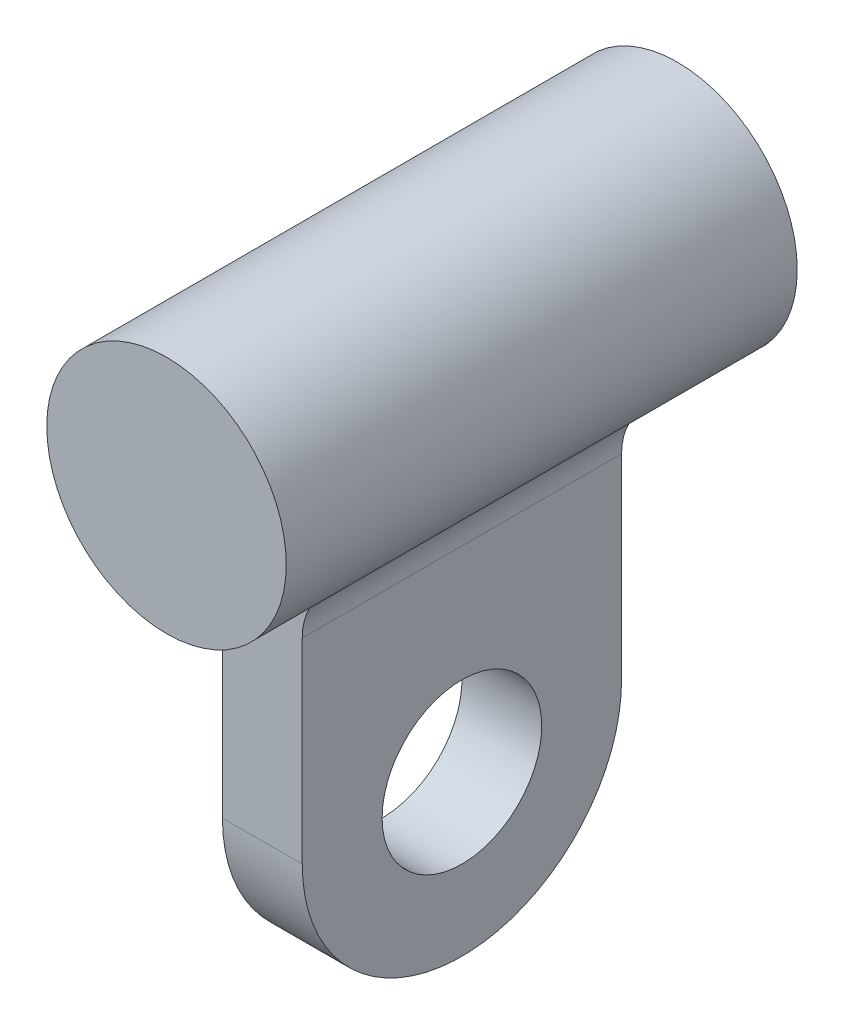
from build123d import *

# Parameters (mm, degrees)
SKETCH1_R           = 4.7625
BOSS_EXTRUDE1_DEPTH = 20.32
SKETCH2_W           = 3.175
SKETCH2_H           = 12.7
BOSS_EXTRUDE2_DEPTH = 19.05
CUT_EXTRUDE1_DEPTH  = 37.015654929
SKETCH4_R           = 3.175
CUT_EXTRUDE2_DEPTH  = 37.015654929
FILLET1_R           = 2.54


with BuildPart() as part:
    # Sketch1 → Boss-Extrude1 (new body)
    with BuildSketch(Plane.XY):
        with Locations((-80.781588965, -8.89)):
            Circle(SKETCH1_R)
    extrude(amount=BOSS_EXTRUDE1_DEPTH)

    # Sketch2 → Boss-Extrude2 (add)
    with BuildSketch(Plane(origin=(0, -10, 0), x_dir=(1, 0, 0), z_dir=(0, 1, 0))):
        with Locations((-80.781588965, -10.16)):
            Rectangle(SKETCH2_W, SKETCH2_H)
    extrude(amount=-BOSS_EXTRUDE2_DEPTH)

    # Sketch3 → Cut-Extrude1 (cut, through all)
    with BuildSketch(Plane.ZY.offset(82.369088965)):
        with BuildLine():
            ThreePointArc((10.16, -29.05), (5.669871939, -27.190128061), (3.81, -22.7))
            Line((3.81, -22.7), (3.81, -29.05))
            Line((3.81, -29.05), (10.16, -29.05))
        make_face()
        with BuildLine():
            ThreePointArc((16.51, -22.7), (14.650128061, -27.190128061), (10.16, -29.05))
            Line((10.16, -29.05), (16.51, -29.05))
            Line((16.51, -29.05), (16.51, -22.7))
        make_face()
    extrude(amount=-CUT_EXTRUDE1_DEPTH, mode=Mode.SUBTRACT)

    # Sketch4 → Cut-Extrude2 (cut, through all)
    with BuildSketch(Plane.ZY.offset(82.369088965)):
        with Locations((10.16, -22.7)):
            Circle(SKETCH4_R)
    extrude(amount=-CUT_EXTRUDE2_DEPTH, mode=Mode.SUBTRACT)

    # Fillet1
    fillet1_edges = [part.edges().sort_by_distance(p)[0] for p in [
        (-79.194088965, -13.380128061, 10.16),
        (-82.369088965, -13.380128061, 10.16),
    ]]
    fillet(fillet1_edges, radius=FILLET1_R)


solid = part.part
